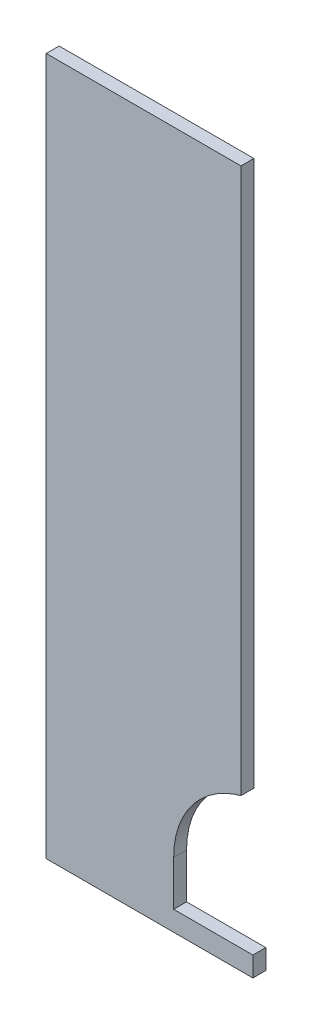
from build123d import *

# Parameters (mm, degrees)
BOSS_EXTRU_1_DEPTH = 5


with BuildPart() as part:
    # Esquisse1 → Boss.-Extru.1 (new body)
    with BuildSketch(Plane.XY):
        with BuildLine():
            Line((0, 0), (80, 0))
            Line((80, 0), (80, 7.703928201))
            Line((80, 7.703928201), (49.330858803, 7.703928201))
            Line((49.330858803, 7.703928201), (49.330858803, 25.109342079))
            add(Edge.make_bspline(
                [(75.398335118, 58.843260951), (49.330858803, 51.744228963), (49.330858803, 25.109342079)],
                knots=[1.84058871, 1.84058871, 1.84058871, 3.141592654, 3.141592654, 3.141592654], degree=2, weights=[1, 0.795779912, 1]))
            Line((75.398335118, 58.843260951), (75.398335118, 270))
            Line((75.398335118, 270), (0, 270))
            Line((0, 270), (0, 0))
        make_face()
    extrude(amount=BOSS_EXTRU_1_DEPTH)


solid = part.part
